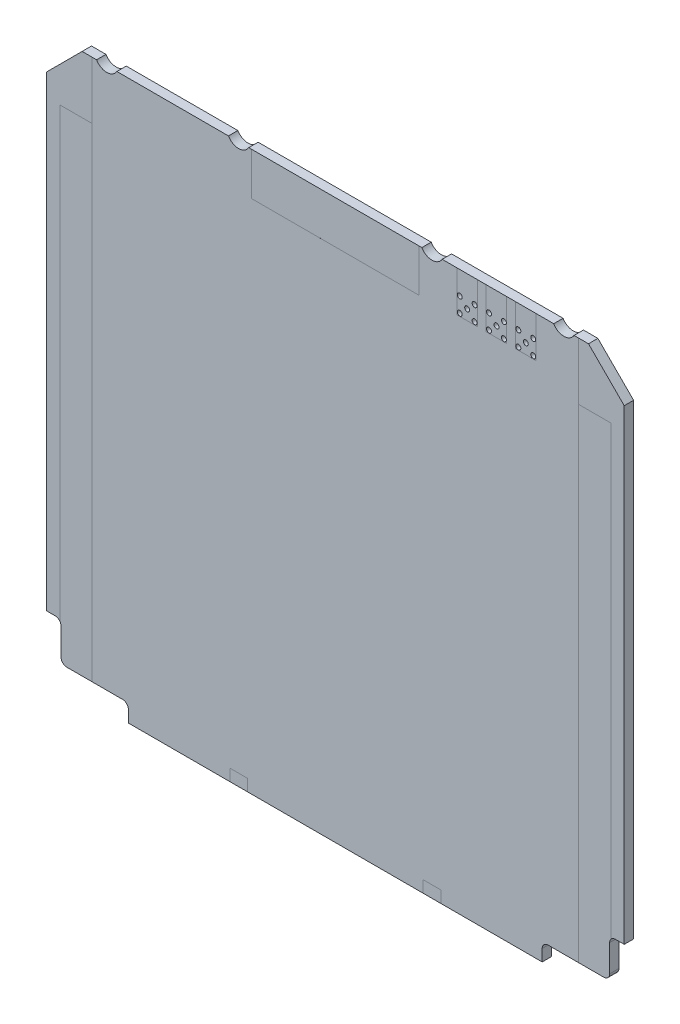
from build123d import *

# Parameters (mm, degrees)
SKETCH1_W                            = 98.6
SKETCH1_H                            = 95.3
BASICSIZE_DEPTH                      = 1.6
CHAMFER1_SIZE                        = 6.1
BACKPLANESIDESCREWCUTOUT_DEPTH       = 71.235674696
LPATTERN3_COUNT                      = 2
LPATTERN3_PITCH                      = 22.5
MIRROR3_COPY_1_DEPTH                 = 71.235674696
MIRROR3_COPY_2_DEPTH                 = 71.235674696
CUT_EXTRUDE4_DEPTH                   = 71.235674696
FILLET1_R                            = 1
FILLET1_OF_MIRROR1_R                 = 1
SKETCH5_R                            = 0.425
CUT_EXTRUDE3_DEPTH                   = 71.235674696
LPATTERN2_COUNT                      = 3
LPATTERN2_PITCH                      = 5
PARTFOOTPRINTS_W                     = 3.5
PARTFOOTPRINTS_H                     = 6.95
MMCXFOOTPRINT_DEPTH                  = 0.0001
SKETCH7_W                            = 28.575
SKETCH7_H                            = 7.293
TIGEREYEFOOTPRINT_DEPTH              = 0.0001
KEEPOUT_BOTTOM_DEPTH                 = 0.0001
CAUTION_TOP_START                    = -0.00015
CAUTION_TOP_DEPTH                    = 0.00015
HOLD_DOWNLOCATIONS_W                 = 3
HOLD_DOWNLOCATIONS_H                 = 2
HOLD_DOWNFOOTPRINTS_DEPTH            = 0.0001
CLEARANCES_SIDE_SIDE_COPY_1_DEPTH    = 0.0001
CLEARANCES_SIDE_SIDE_START           = -0.00015
CLEARANCES_SIDE_SIDE_COPY_2_DEPTH    = 0.00015
CLEARANCES_SIDE_SIDE_COPY_3_SKETCH_W = 3
CLEARANCES_SIDE_SIDE_COPY_3_SKETCH_H = 2
CLEARANCES_SIDE_SIDE_COPY_3_DEPTH    = 0.0001
CLEARANCES_SIDE_SIDE_COPY_4_DEPTH    = 0.0001
CLEARANCES_SIDE_SIDE_COPY_5_DEPTH    = 0.00015
CLEARANCES_SIDE_SIDE_COPY_6_SKETCH_W = 3
CLEARANCES_SIDE_SIDE_COPY_6_SKETCH_H = 2
CLEARANCES_SIDE_SIDE_COPY_6_DEPTH    = 0.0001


with BuildPart() as part:
    # Sketch1 → basicSize (new body)
    with BuildSketch(Plane(origin=(0, 0, -0.0125), x_dir=(-1, 0, 0), z_dir=(0, 0, -1))):
        with Locations((0, -2.35)):
            Rectangle(SKETCH1_W, SKETCH1_H)
    extrude(amount=-BASICSIZE_DEPTH)

    # Chamfer1
    chamfer1_edges = [part.edges().sort_by_distance(p)[0] for p in [
        (49.3, 45.3, 0.7875),
        (-49.3, 45.3, 0.7875),
    ]]
    chamfer(chamfer1_edges, length=CHAMFER1_SIZE)

    # Sketch4 → backplaneSideScrewCutout (cut, symmetric)
    with BuildSketch(Plane.XY.offset(1.5875)):
        with BuildLine():
            Line((37.267949192, 45.3), (40.732050808, 45.3))
            ThreePointArc((40.732050808, 45.3), (39, 44.3), (37.267949192, 45.3))
        make_face()
    backplanesidescrewcutout = extrude(amount=BACKPLANESIDESCREWCUTOUT_DEPTH, both=True, mode=Mode.SUBTRACT)

    # LPattern3: backplaneSideScrewCutout ×2
    with Locations(*[(-i * LPATTERN3_PITCH, 0, 0) for i in range(1, LPATTERN3_COUNT)]):
        add(backplanesidescrewcutout, mode=Mode.SUBTRACT)

    # Mirror3 copy 1 sketch → Mirror3 copy 1 (cut, symmetric)
    with BuildSketch(Plane(origin=(22.5, 0, 1.5875), x_dir=(-1, 0, 0), z_dir=(0, 0, 1))):
        with BuildLine():
            Line((37.267949192, -45.3), (40.732050808, -45.3))
            ThreePointArc((40.732050808, -45.3), (39, -44.3), (37.267949192, -45.3))
        make_face()
    extrude(amount=MIRROR3_COPY_1_DEPTH, both=True, mode=Mode.SUBTRACT)

    # Mirror3 copy 2 sketch → Mirror3 copy 2 (cut, symmetric)
    with BuildSketch(Plane(origin=(0, 0, 1.5875), x_dir=(-1, 0, 0), z_dir=(0, 0, 1))):
        with BuildLine():
            Line((37.267949192, -45.3), (40.732050808, -45.3))
            ThreePointArc((40.732050808, -45.3), (39, -44.3), (37.267949192, -45.3))
        make_face()
    extrude(amount=MIRROR3_COPY_2_DEPTH, both=True, mode=Mode.SUBTRACT)

    # Sketch6 → Cut-Extrude4 (cut, through all)
    with BuildSketch(Plane.XY.offset(1.5875)):
        Polygon((-49.3, -40.4), (-46.8, -40.4), (-46.8, -47), (-35.3, -47), (-35.3, -50), (-49.3, -50), align=None)
    cut_extrude4 = extrude(amount=-CUT_EXTRUDE4_DEPTH, mode=Mode.SUBTRACT)

    # Fillet1
    fillet1_edges = [part.edges().sort_by_distance(p)[0] for p in [
        (-35.3, -47, 0.7875),
        (-46.8, -47, 0.7875),
        (-46.8, -40.4, 0.7875),
    ]]
    fillet(fillet1_edges, radius=FILLET1_R)

    # Mirror1: Cut-Extrude4 across plane
    add(cut_extrude4.mirror(Plane(origin=(0, 0, 0), x_dir=(0, 0, 1), z_dir=(1, 0, 0))), mode=Mode.SUBTRACT)

    # Fillet1 of Mirror1
    fillet1_of_mirror1_edges = [part.edges().sort_by_distance(p)[0] for p in [
        (35.3, -47, 0.7875),
        (46.8, -47, 0.7875),
        (46.8, -40.4, 0.7875),
    ]]
    fillet(fillet1_of_mirror1_edges, radius=FILLET1_OF_MIRROR1_R)

    # Sketch5 → Cut-Extrude3 (cut, through all)
    with BuildSketch(Plane.XY.offset(1.5875)):
        with Locations((22.5, 40.1)):
            Circle(SKETCH5_R)
        with Locations((21.23, 41.37)):
            Circle(SKETCH5_R)
        with Locations((21.23, 38.83)):
            Circle(SKETCH5_R)
        with Locations((23.77, 41.37)):
            Circle(SKETCH5_R)
        with Locations((23.77, 38.83)):
            Circle(SKETCH5_R)
    cut_extrude3 = extrude(amount=-CUT_EXTRUDE3_DEPTH, mode=Mode.SUBTRACT)

    # LPattern2: Cut-Extrude3 ×3
    with Locations(*[(i * LPATTERN2_PITCH, 0, 0) for i in range(1, LPATTERN2_COUNT)]):
        add(cut_extrude3, mode=Mode.SUBTRACT)

    # partFootprints → MMCXfootprint (cut)
    with BuildSketch(Plane.XY.offset(1.5875)):
        with Locations((22.5, 41.825)):
            Rectangle(PARTFOOTPRINTS_W, PARTFOOTPRINTS_H)
        with Locations((27.5, 41.825)):
            Rectangle(PARTFOOTPRINTS_W, PARTFOOTPRINTS_H)
        with Locations((32.5, 41.825)):
            Rectangle(PARTFOOTPRINTS_W, PARTFOOTPRINTS_H)
    extrude(amount=-MMCXFOOTPRINT_DEPTH, mode=Mode.SUBTRACT)

    # Sketch7 → TigerEyeFootprint (cut)
    with BuildSketch(Plane.XY.offset(1.5875)):
        with Locations((0, 41.6535)):
            Rectangle(SKETCH7_W, SKETCH7_H)
    extrude(amount=-TIGEREYEFOOTPRINT_DEPTH, mode=Mode.SUBTRACT)

    # thermalContacts_upper → keepOut_bottom (cut)
    with BuildSketch(Plane.XY.offset(1.5875)):
        Polygon((-47, 35.5), (-47, -41.5), (-56.192158269, -41.5), (-56.192158269, 47), (-41.5, 47), (-41.5, 35.5), align=None)
    keepout_bottom = extrude(amount=-KEEPOUT_BOTTOM_DEPTH, mode=Mode.SUBTRACT)

    # Sketch3 → caution_top (cut)
    with BuildSketch(Plane.XY.offset(1.5875).offset(CAUTION_TOP_START)):
        with BuildLine():
            Line((-41.5, 35.5), (-47, 35.5))
            Line((-47, 35.5), (-47, -40.8))
            ThreePointArc((-47, -40.8), (-46.851316702, -41.083772234), (-46.8, -41.4))
            Line((-46.8, -41.4), (-46.8, -46))
            ThreePointArc((-46.8, -46), (-46.507106781, -46.707106781), (-45.8, -47))
            Line((-45.8, -47), (-41.5, -47))
            Line((-41.5, -47), (-41.5, 35.5))
        make_face()
    caution_top = extrude(amount=CAUTION_TOP_DEPTH, mode=Mode.SUBTRACT)

    # hold-downLocations → hold-downFootprints (cut)
    with BuildSketch(Plane.XY.offset(1.5875)):
        with Locations((16.5, -49)):
            Rectangle(HOLD_DOWNLOCATIONS_W, HOLD_DOWNLOCATIONS_H)
    hold_downfootprints = extrude(amount=-HOLD_DOWNFOOTPRINTS_DEPTH, mode=Mode.SUBTRACT)

    # clearances_top-bottom: keepOut_bottom, caution_top, hold-downFootprints across plane
    add(keepout_bottom.mirror(Plane.XY.offset(0.7875)), mode=Mode.SUBTRACT)
    add(caution_top.mirror(Plane.XY.offset(0.7875)), mode=Mode.SUBTRACT)
    add(hold_downfootprints.mirror(Plane.XY.offset(0.7875)), mode=Mode.SUBTRACT)

    # clearances_side-side copy 1 sketch → clearances_side-side copy 1 (cut)
    with BuildSketch(Plane(origin=(0, 0, -0.0125), x_dir=(-1, 0, 0), z_dir=(0, 0, -1))):
        Polygon((-47, 35.5), (-47, -41.5), (-56.192158269, -41.5), (-56.192158269, 47), (-41.5, 47), (-41.5, 35.5), align=None)
    extrude(amount=-CLEARANCES_SIDE_SIDE_COPY_1_DEPTH, mode=Mode.SUBTRACT)

    # clearances_side-side copy 2 sketch → clearances_side-side copy 2 (cut)
    with BuildSketch(Plane(origin=(0, 0, -0.0125), x_dir=(-1, 0, 0), z_dir=(0, 0, -1)).offset(CLEARANCES_SIDE_SIDE_START)):
        with BuildLine():
            Line((-41.5, 35.5), (-47, 35.5))
            Line((-47, 35.5), (-47, -40.8))
            ThreePointArc((-47, -40.8), (-46.851316702, -41.083772234), (-46.8, -41.4))
            Line((-46.8, -41.4), (-46.8, -46))
            ThreePointArc((-46.8, -46), (-46.507106781, -46.707106781), (-45.8, -47))
            Line((-45.8, -47), (-41.5, -47))
            Line((-41.5, -47), (-41.5, 35.5))
        make_face()
    extrude(amount=CLEARANCES_SIDE_SIDE_COPY_2_DEPTH, mode=Mode.SUBTRACT)

    # clearances_side-side copy 3 sketch → clearances_side-side copy 3 (cut)
    with BuildSketch(Plane(origin=(0, 0, -0.0125), x_dir=(-1, 0, 0), z_dir=(0, 0, -1))):
        with Locations((16.5, -49)):
            Rectangle(CLEARANCES_SIDE_SIDE_COPY_3_SKETCH_W, CLEARANCES_SIDE_SIDE_COPY_3_SKETCH_H)
    extrude(amount=-CLEARANCES_SIDE_SIDE_COPY_3_DEPTH, mode=Mode.SUBTRACT)

    # clearances_side-side copy 4 sketch → clearances_side-side copy 4 (cut)
    with BuildSketch(Plane(origin=(0, 0, 1.5875), x_dir=(-1, 0, 0), z_dir=(0, 0, 1))):
        Polygon((-47, -35.5), (-47, 41.5), (-56.192158269, 41.5), (-56.192158269, -47), (-41.5, -47), (-41.5, -35.5), align=None)
    extrude(amount=-CLEARANCES_SIDE_SIDE_COPY_4_DEPTH, mode=Mode.SUBTRACT)

    # clearances_side-side copy 5 sketch → clearances_side-side copy 5 (cut)
    with BuildSketch(Plane(origin=(0, 0, 1.5875), x_dir=(-1, 0, 0), z_dir=(0, 0, 1)).offset(CLEARANCES_SIDE_SIDE_START)):
        with BuildLine():
            Line((-41.5, -35.5), (-47, -35.5))
            Line((-47, -35.5), (-47, 40.8))
            ThreePointArc((-47, 40.8), (-46.851316702, 41.083772234), (-46.8, 41.4))
            Line((-46.8, 41.4), (-46.8, 46))
            ThreePointArc((-46.8, 46), (-46.507106781, 46.707106781), (-45.8, 47))
            Line((-45.8, 47), (-41.5, 47))
            Line((-41.5, 47), (-41.5, -35.5))
        make_face()
    extrude(amount=CLEARANCES_SIDE_SIDE_COPY_5_DEPTH, mode=Mode.SUBTRACT)

    # clearances_side-side copy 6 sketch → clearances_side-side copy 6 (cut)
    with BuildSketch(Plane(origin=(0, 0, 1.5875), x_dir=(-1, 0, 0), z_dir=(0, 0, 1))):
        with Locations((16.5, 49)):
            Rectangle(CLEARANCES_SIDE_SIDE_COPY_6_SKETCH_W, CLEARANCES_SIDE_SIDE_COPY_6_SKETCH_H)
    extrude(amount=-CLEARANCES_SIDE_SIDE_COPY_6_DEPTH, mode=Mode.SUBTRACT)


solid = part.part
